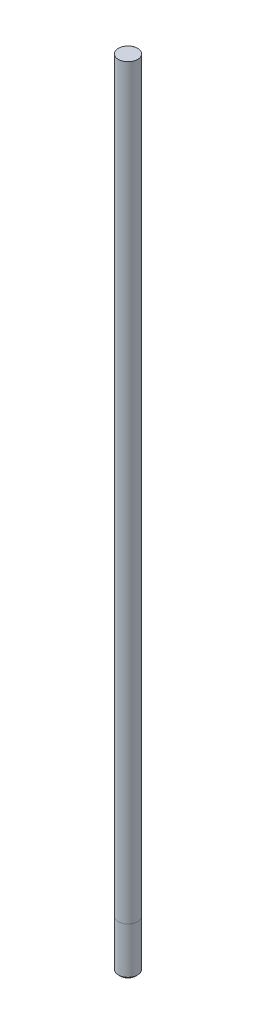
from build123d import *

# Parameters (mm, degrees)
SKETCH_1_R      = 4
EXTRUDE_1_DEPTH = 330


# Read off the part's stored shape, not the designer's step: 5/16-18 机械螺纹 螺柱1
with BuildPart() as part:
    # 草图1 → 凸台-拉伸1 (new body)
    with BuildSketch(Plane(origin=(0, 0, 0), x_dir=(1, 0, 0), z_dir=(0, 1, 0))):
        with Locations(Location((0, 0, 0), (0, 0, 270))):
            Circle(SKETCH_1_R)
    extrude(amount=EXTRUDE_1_DEPTH)

    # 5/16-18 机械螺纹 螺柱1 outline → 5/16-18 机械螺纹 螺柱1 (revolve, cut)
    with BuildSketch(Plane.XY):
        Polygon((3.12928, 0), (4, 0), (4, 20), (3.96875, 20), (3.96875, 0.83947), align=None)
    revolve(axis=Axis((0, 0, 0), (0, 1, 0)), mode=Mode.SUBTRACT)


solid = part.part
